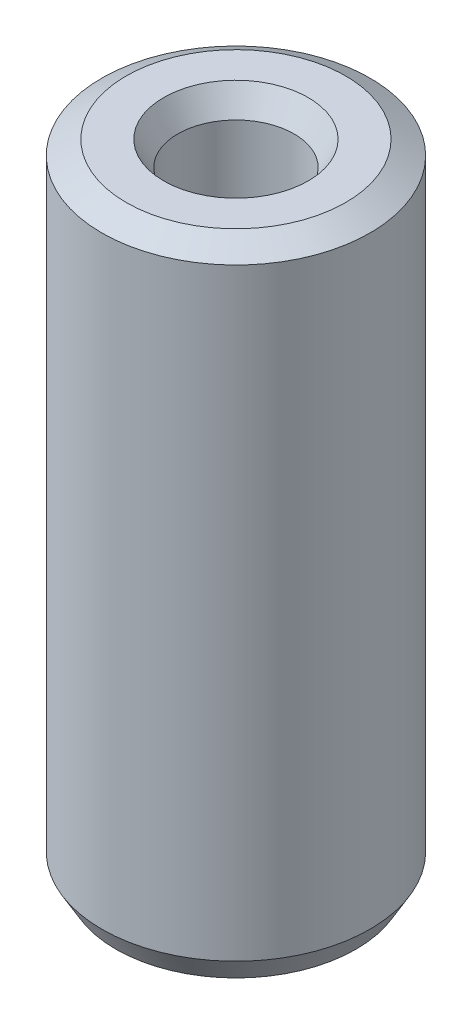
from build123d import *
from OCP.BRepFilletAPI import BRepFilletAPI_MakeChamfer

# Parameters (mm, degrees)
SKETCH1_R           = 5
BOSS_EXTRUDE1_DEPTH = 23.913029692
SKETCH2_R           = 2.167819188
CUT_EXTRUDE1_DEPTH  = 25.936579338
CHAMFER1_SIZE       = 0.525823219
CHAMFER1_SIZE2      = 0.910752531


with BuildPart() as part:
    # Sketch1 → Boss-Extrude1 (new body)
    with BuildSketch(Plane(origin=(0, 0, 0), x_dir=(1, 0, 0), z_dir=(0, 1, 0))):
        Circle(SKETCH1_R)
    extrude(amount=BOSS_EXTRUDE1_DEPTH)

    # Sketch2 → Cut-Extrude1 (cut, through all)
    with BuildSketch(Plane(origin=(0, 0, 0), x_dir=(1, 0, 0), z_dir=(0, 1, 0))):
        Circle(SKETCH2_R)
    extrude(amount=CUT_EXTRUDE1_DEPTH, mode=Mode.SUBTRACT)

    # Chamfer1: one chamfer whose edges measure the first distance from different faces: ONE call of the kernel's chamfer builder (chamfer() names one face for all edges)
    chamfer1_edges_1 = [part.edges().sort_by_distance(p)[0] for p in [
        (-2.167819188, 23.913029692, 0),
    ]]
    chamfer1_side_1 = [part.faces().sort_by_distance(p)[0] for p in [
        (-4.858578644, 23.913029692, 0),
    ]]
    chamfer1_edges_2 = [part.edges().sort_by_distance(p)[0] for p in [
        (-2.167819188, 0, 0),
    ]]
    chamfer1_side_2 = [part.faces().sort_by_distance(p)[0] for p in [
        (-2.167819188, 11.956514846, 0),
    ]]
    chamfer1_edges_3 = [part.edges().sort_by_distance(p)[0] for p in [
        (-5, 0, 0),
    ]]
    chamfer1_side_3 = [part.faces().sort_by_distance(p)[0] for p in [
        (-4.858578644, 0, 0),
    ]]
    chamfer1_edges_4 = [part.edges().sort_by_distance(p)[0] for p in [
        (-5, 23.913029692, 0),
    ]]
    chamfer1_side_4 = [part.faces().sort_by_distance(p)[0] for p in [
        (-5, 11.956514846, 0),
    ]]
    chamfer1 = BRepFilletAPI_MakeChamfer(part.part.solid().wrapped)
    for e in chamfer1_edges_1:
        chamfer1.Add(CHAMFER1_SIZE, CHAMFER1_SIZE2, e.wrapped, chamfer1_side_1[0].wrapped)  # the first distance lies on this face
    for e in chamfer1_edges_2:
        chamfer1.Add(CHAMFER1_SIZE, CHAMFER1_SIZE2, e.wrapped, chamfer1_side_2[0].wrapped)  # the first distance lies on this face
    for e in chamfer1_edges_3:
        chamfer1.Add(CHAMFER1_SIZE, CHAMFER1_SIZE2, e.wrapped, chamfer1_side_3[0].wrapped)  # the first distance lies on this face
    for e in chamfer1_edges_4:
        chamfer1.Add(CHAMFER1_SIZE, CHAMFER1_SIZE2, e.wrapped, chamfer1_side_4[0].wrapped)  # the first distance lies on this face
    add(Compound.cast(chamfer1.Shape()), mode=Mode.REPLACE)


solid = part.part
